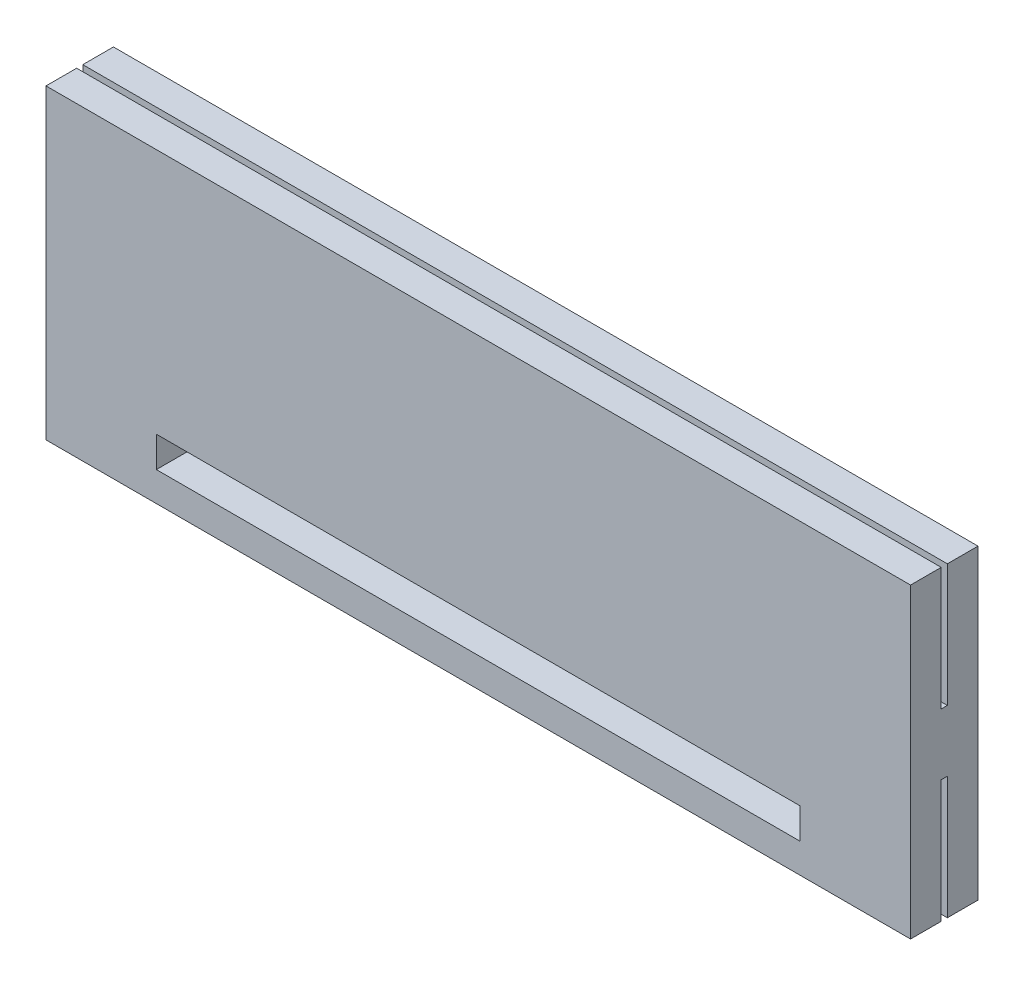
from build123d import *

# Parameters (mm, degrees)
BOSS_EXTRUDE1_DEPTH            = 141
BOSS_EXTRUDE1_DEPTH_BACK       = 141
SKETCH1_W                      = 22
SKETCH1_H                      = 100
CAVITY1_START                  = -2
CAVITY1_OUTLINE_W              = 282
CAVITY1_OUTLINE_H              = 40
CAVITY1_DEPTH                  = 2
CUT_EXTRUDE1_REACH             = 280.613
SKETCH2_W                      = 210
SKETCH2_H                      = 10
CUT_EXTRUDE1_DIRECTION_2_REACH = 280.613


# Read off the part's stored shape, not the designer's step: Cavity1
with BuildPart() as part:
    # Sketch1 → Boss-Extrude1 (new, two sides: drawn at the far end of the back side and taken through both)
    with BuildSketch(Plane(origin=(0, 0, 0), x_dir=(0, 0, -1), z_dir=(1, 0, 0)).offset(-BOSS_EXTRUDE1_DEPTH_BACK)):
        with Locations((1, -190)):
            Rectangle(SKETCH1_W, SKETCH1_H)
    extrude(amount=BOSS_EXTRUDE1_DEPTH + BOSS_EXTRUDE1_DEPTH_BACK)

    # Cavity1 outline → Cavity1 (cut)
    with BuildSketch(Plane.XY.offset(CAVITY1_START)):
        with Locations((0, -160)):
            Rectangle(CAVITY1_OUTLINE_W, CAVITY1_OUTLINE_H)
    cavity1 = extrude(amount=CAVITY1_DEPTH, mode=Mode.SUBTRACT)

    # Mirror1: Cavity1 across plane
    add(cavity1.mirror(Plane.ZX.offset(-190)), mode=Mode.SUBTRACT)

    # Cut-Extrude1: up to this face of the body (flat: up to its plane)
    cut_extrude1_end = Plane(part.part.faces().sort_by_distance((0, -190, 10))[0])
    # Sketch2 → Cut-Extrude1 (cut, up to the picked face)
    with BuildSketch(Plane(origin=(0, 0, 0), x_dir=(-1, 0, 0), z_dir=(0, 0, -1)), mode=Mode.PRIVATE) as cut_extrude1_sk1:
        with Locations((0, -225.386342941)):
            Rectangle(SKETCH2_W, SKETCH2_H)
    cut_extrude1_tool1 = split(extrude(cut_extrude1_sk1.sketch, amount=-CUT_EXTRUDE1_REACH, mode=Mode.PRIVATE), bisect_by=cut_extrude1_end, keep=Keep.BOTH, mode=Mode.PRIVATE)
    add(cut_extrude1_tool1.solids().sort_by(Axis((0, -225.386343, 0), (0, 0, 1)))[0], mode=Mode.SUBTRACT)

    # Cut-Extrude1 direction 2: up to this face of the body (flat: up to its plane)
    cut_extrude1_direction_2_end = Plane(part.part.faces().sort_by_distance((0, -190, -12))[0])
    # Sketch2 → Cut-Extrude1 direction 2 (cut, up to the picked face)
    with BuildSketch(Plane(origin=(0, 0, 0), x_dir=(-1, 0, 0), z_dir=(0, 0, -1)), mode=Mode.PRIVATE) as cut_extrude1_direction_2_sk1:
        with Locations((0, -225.386342941)):
            Rectangle(SKETCH2_W, SKETCH2_H)
    cut_extrude1_direction_2_tool1 = split(extrude(cut_extrude1_direction_2_sk1.sketch, amount=CUT_EXTRUDE1_DIRECTION_2_REACH, mode=Mode.PRIVATE), bisect_by=cut_extrude1_direction_2_end, keep=Keep.BOTH, mode=Mode.PRIVATE)
    add(cut_extrude1_direction_2_tool1.solids().sort_by(Axis((0, -225.386343, 0), (0, 0, -1)))[0], mode=Mode.SUBTRACT)


solid = part.part
